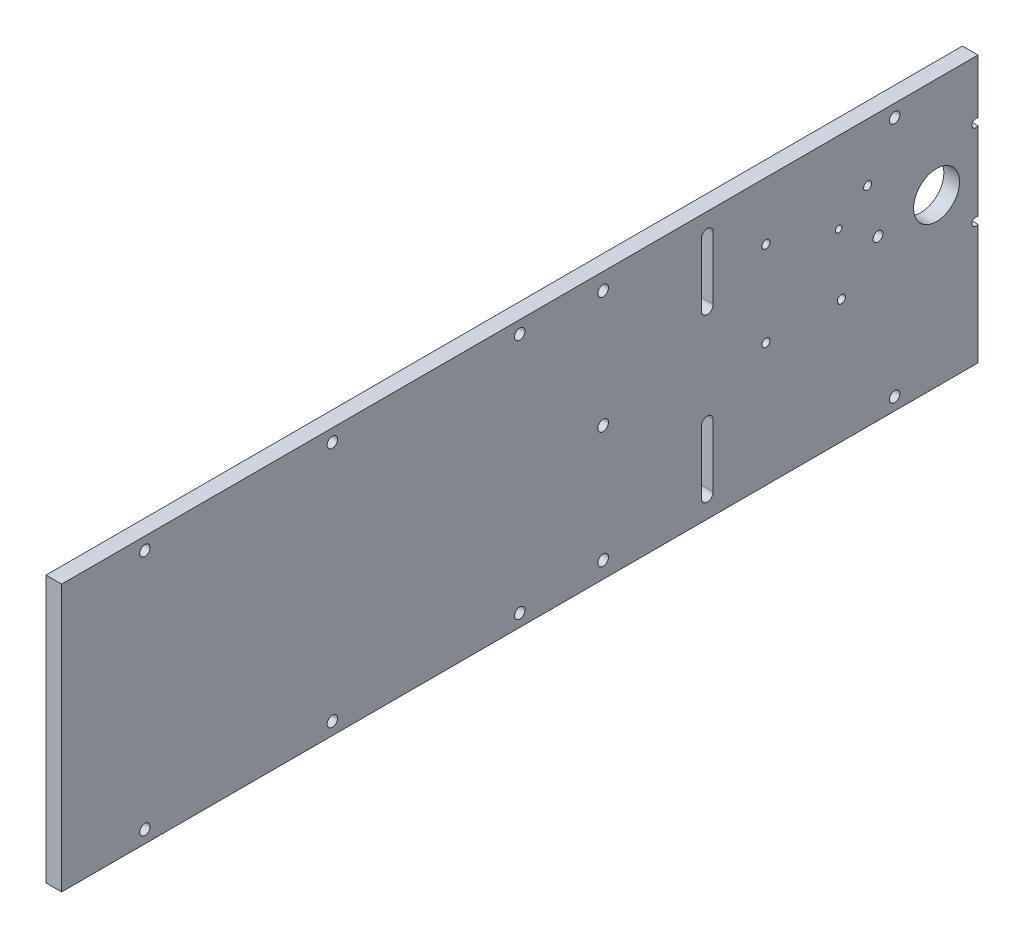
from build123d import *

# Parameters (mm, degrees)
SKETCH1_W                     = 279.4
SKETCH1_H                     = 81.28
BOSS_EXTRUDE1_DEPTH           = 4.7625
SKETCH2_R                     = 6.9977
SKETCH2_R_2                   = 1.4986
SKETCH2_R_3                   = 0.9906
SKETCH2_R_4                   = 4.7625
GEARBOX_WITH_PRESS_FITS_DEPTH = 316.363404917
SKETCH6_R                     = 1.59385
CUT_EXTRUDE2_DEPTH            = 316.363404917
F_4_CLEARANCE_HOLE2_D         = 3.2639
F_2_CLEARANCE_HOLE1_D         = 2.4384
F_2_CLEARANCE_HOLE1_DEPTH     = 4.826
F_2_CLEARANCE_HOLE1_TIP       = 0.732569267


with BuildPart() as part:
    # Sketch1 → Boss-Extrude1 (new body)
    with BuildSketch(Plane(origin=(0, 0, 0), x_dir=(0, 0, -1), z_dir=(1, 0, 0))):
        with Locations((172.997595377, 0)):
            Rectangle(SKETCH1_W, SKETCH1_H)
    extrude(amount=BOSS_EXTRUDE1_DEPTH)

    # Sketch2 → Gearbox (with Press fits) (cut, through all)
    with BuildSketch(Plane(origin=(4.7625, 0, 0), x_dir=(0, 0, -1), z_dir=(1, 0, 0))):
        with Locations((300.047997426, 10)):
            Circle(SKETCH2_R)
        with Locations((282.214696722, 8)):
            Circle(SKETCH2_R_2)
        with Locations((270.217776392, 15.933400182)):
            Circle(SKETCH2_R_3)
        with Locations((331.004197426, 10)):
            Circle(SKETCH2_R_4)
    extrude(amount=-GEARBOX_WITH_PRESS_FITS_DEPTH, mode=Mode.SUBTRACT)

    # Sketch6 → Cut-Extrude2 (cut, through all)
    with BuildSketch(Plane(origin=(4.7625, 0, 0), x_dir=(0, 0, -1), z_dir=(1, 0, 0))):
        with Locations((287.297595377, 36.83)):
            Circle(SKETCH6_R)
        with Locations((172.997595377, 36.83)):
            Circle(SKETCH6_R)
        with Locations((115.847595377, 36.83)):
            Circle(SKETCH6_R)
        with Locations((58.697595377, 36.83)):
            Circle(SKETCH6_R)
        with Locations((58.697595377, -36.83)):
            Circle(SKETCH6_R)
        with Locations((115.847595377, -36.83)):
            Circle(SKETCH6_R)
        with Locations((172.997595377, -36.83)):
            Circle(SKETCH6_R)
        with Locations((287.297595377, -36.83)):
            Circle(SKETCH6_R)
        with BuildLine():
            Line((231.976395377, 34.29), (231.976395377, 15.24))
            ThreePointArc((231.976395377, 15.24), (230.147595377, 13.4112), (228.318795377, 15.24))
            Line((228.318795377, 15.24), (228.318795377, 34.29))
            ThreePointArc((228.318795377, 34.29), (230.147595377, 36.1188), (231.976395377, 34.29))
        make_face()
        with BuildLine():
            Line((231.976395377, -34.29), (231.976395377, -15.24))
            ThreePointArc((231.976395377, -15.24), (230.147595377, -13.4112), (228.318795377, -15.24))
            Line((228.318795377, -15.24), (228.318795377, -34.29))
            ThreePointArc((228.318795377, -34.29), (230.147595377, -36.1188), (231.976395377, -34.29))
        make_face()
    extrude(amount=-CUT_EXTRUDE2_DEPTH, mode=Mode.SUBTRACT)

    # #4 Clearance Hole2 (through all)
    with Locations(Plane(origin=(4.7625, 0, 0), x_dir=(0, 0, -1), z_dir=(1, 0, 0))):
        with Locations((198.397595377, 35.56), (198.397595377, -35.56), (198.397595377, 0)):
            Hole(F_4_CLEARANCE_HOLE2_D / 2)

    # #2 Clearance Hole1
    with Locations(Plane(origin=(4.7625, 0, 0), x_dir=(0, 0, -1), z_dir=(1, 0, 0))):
        with Locations((248.047997486, -3), (248.047997486, 23), (271.047997556, -3), (312.047997486, -3), (279.047997486, 23), (312.047997486, 23), (335.047997486, 23), (335.047997486, -3)):
            Hole(F_2_CLEARANCE_HOLE1_D / 2, depth=F_2_CLEARANCE_HOLE1_DEPTH)
            with Locations((0, 0, -(F_2_CLEARANCE_HOLE1_DEPTH + F_2_CLEARANCE_HOLE1_TIP / 2))):  # 118° drill point
                Cone(0, F_2_CLEARANCE_HOLE1_D / 2, F_2_CLEARANCE_HOLE1_TIP, mode=Mode.SUBTRACT)


solid = part.part
